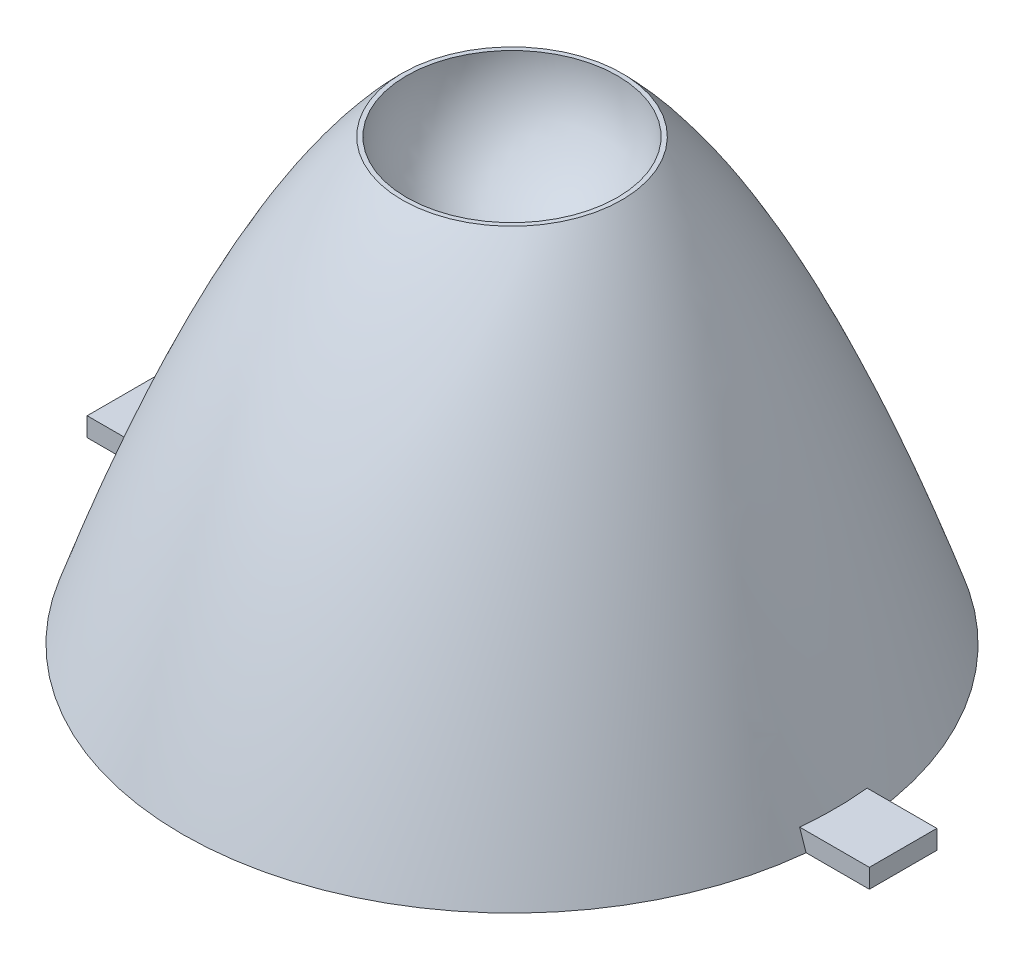
from build123d import *

# Parameters (mm, degrees)
BOSS_EXTRUDE1_REACH = 28.188
SKETCH6_W           = 1.95
SKETCH6_H           = 0.55


# Read off the part's stored shape, not the designer's step: Revolve1
with BuildPart() as part:
    # Revolve1 outline → Revolve1 (revolve)
    with BuildSketch(Plane.XY):
        with BuildLine():
            Line((0, -3.048000121), (0, -6.747666043))
            ThreePointArc((0, -6.747666043), (2.031291213, -6.02834824), (3.157219843, -4.191000475))
            Line((3.157219843, -4.191000475), (3.175005592, -5.209936836))
            Line((3.175005592, -5.209936836), (3.175005592, -3.048000121))
            Line((3.175005592, -3.048000121), (0, -3.048000121))
        make_face()
        with BuildLine():
            ThreePointArc((3.047999762, -2.63e-07), (2.155261335, -2.155261626), (0, -3.048000121))
            Line((0, -3.048000121), (3.175005592, -3.048000121))
            Line((3.175005592, -3.048000121), (3.175005592, -2.63e-07))
            Line((3.175005592, -2.63e-07), (3.047999762, -2.63e-07))
        make_face()
        with BuildLine():
            Line((3.175005592, -3.048000121), (3.175005592, -5.209936836))
            Line((3.175005592, -5.209936836), (3.201846755, -6.747666043))
            Line((3.201846755, -6.747666043), (7.27518656, -6.747666043))
            add(Edge.make_bspline(
                [(7.27518656, -6.747666043), (7.21368894, -6.606752773), (6.964928048, -6.043911737), (6.546096871, -5.144737962), (6.026061135, -4.11883899), (5.658022957, -3.448984329), (5.463723236, -3.113412693), (5.425444316, -3.048000121)],
                knots=[0.445044946, 0.445044946, 0.445044946, 0.445044946, 0.477293423, 0.574115344, 0.653072781, 0.718507442, 0.734404118, 0.734404118, 0.734404118, 0.734404118], degree=3))
            Line((5.425444316, -3.048000121), (3.175005592, -3.048000121))
        make_face()
        with BuildLine():
            Line((3.175005592, -5.539e-06), (3.175005592, -3.048000121))
            Line((3.175005592, -3.048000121), (5.425444316, -3.048000121))
            add(Edge.make_bspline(
                [(5.425444316, -3.048000121), (5.331276728, -2.887082722), (5.120346092, -2.535848114), (4.796092557, -2.028683173), (4.466086303, -1.548435358), (4.165682257, -1.140937859), (3.890472725, -0.792449825), (3.569506506, -0.412648033), (3.330841371, -0.155867529), (3.175005592, -5.539e-06)],
                knots=[0.734404118, 0.734404118, 0.734404118, 0.734404118, 0.773510539, 0.820333182, 0.86064682, 0.895714403, 0.926505158, 0.95377342, 1, 1, 1, 1], degree=3))
        make_face()
        with BuildLine():
            Line((7.27518656, -6.747666043), (3.201846755, -6.747666043))
            Line((3.201846755, -6.747666043), (3.30574513, -12.7))
            Line((3.30574513, -12.7), (9.524999537, -12.7))
            add(Edge.make_bspline(
                [(9.524999537, -12.7), (8.986589512, -11.088985259), (8.268131113, -9.090761172), (7.444322602, -7.135217838), (7.27518656, -6.747666043)],
                knots=[0, 0, 0, 0, 0.356352413, 0.445044946, 0.445044946, 0.445044946, 0.445044946], degree=3))
        make_face()
    revolve(axis=Axis((0, 0, 0), (0, 1, 0)))

    # Sketch6 → Boss-Extrude1 (add, up to next)
    with BuildSketch(Plane(origin=(11.3025, 0, 0), x_dir=(0, 0, -1), z_dir=(1, 0, 0)), mode=Mode.PRIVATE) as boss_extrude1_sk1:
        with Locations((0, -12.425)):
            Rectangle(SKETCH6_W, SKETCH6_H)
    boss_extrude1_tool1 = extrude(boss_extrude1_sk1.sketch, amount=-BOSS_EXTRUDE1_REACH, mode=Mode.PRIVATE) - part.part
    boss_extrude1 = boss_extrude1_tool1.solids().sort_by_distance((11.3025, -12.425, 0))[0]
    add(boss_extrude1)

    # Mirror1: Boss-Extrude1 across plane
    add(boss_extrude1.mirror(Plane(origin=(0, 0, 0), x_dir=(0, 0, 1), z_dir=(1, 0, 0))))


solid = part.part
